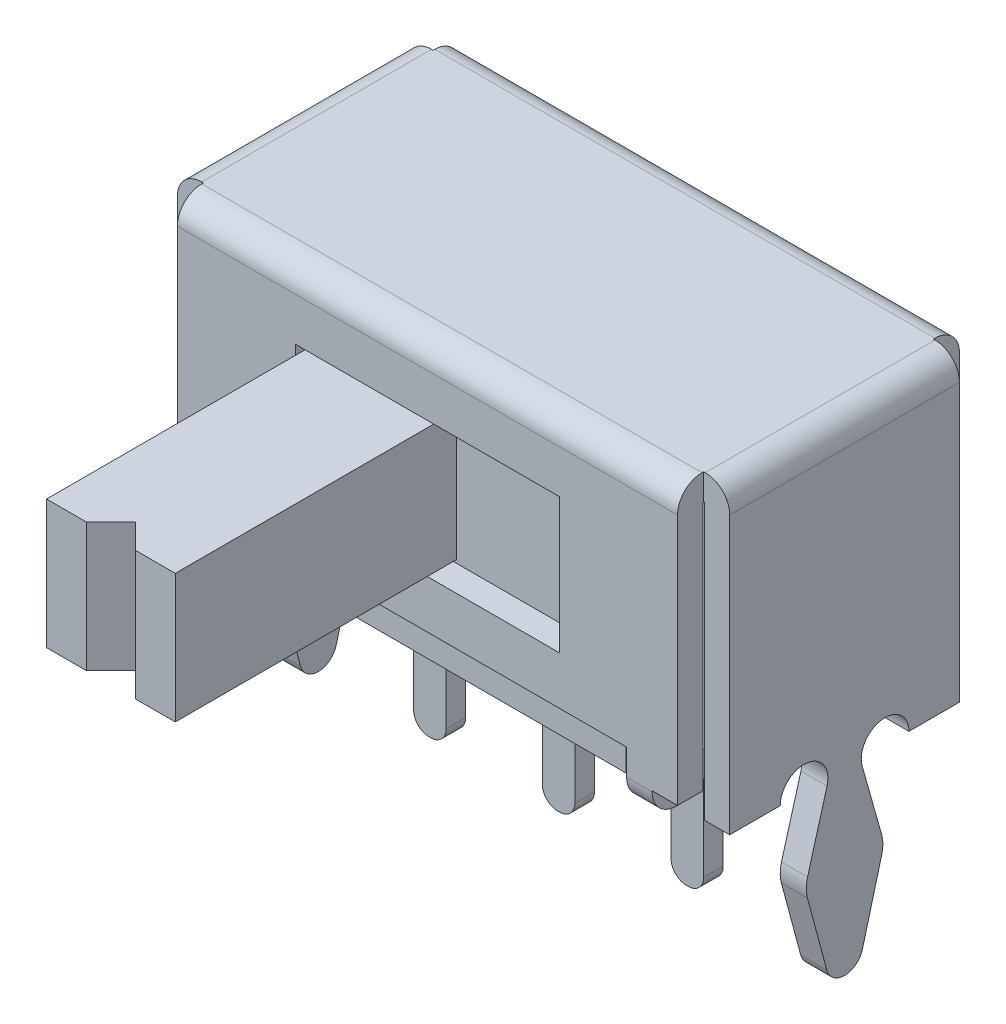
from build123d import *

# Parameters (mm, degrees)
SKETCH1_W           = 8.6106
SKETCH1_H           = 4.3942
BOSS_EXTRUDE1_DEPTH = 7.493
SKETCH2_W           = 0.4064
SKETCH2_H           = 0.4064
CUT_EXTRUDE1_DEPTH  = 13.230963781
CUT_EXTRUDE4_DEPTH  = 7.0866
FILLET8_R           = 0.381
CUT_EXTRUDE5_DEPTH  = 13.230963781
CUT_EXTRUDE6_DEPTH  = 13.230963781
BOSS_EXTRUDE2_DEPTH = 0.396875
SKETCH7_W           = 0.396875
SKETCH7_H           = 0.3937
BOSS_EXTRUDE3_DEPTH = 0.396875
SKETCH8_W           = 0.396875
SKETCH8_H           = 0.396875
BOSS_EXTRUDE4_DEPTH = 0.396875
FILLET9_R           = 0.381
FILLET10_R          = 0.0508
CUT_EXTRUDE7_REACH  = 14.231
SKETCH9_W           = 4.1148
SKETCH9_H           = 2.1082
SKETCH11_W          = 2.0066
SKETCH11_H          = 2.0066
BOSS_EXTRUDE5_DEPTH = 4.384675
SKETCH12_W          = 4.487424853
SKETCH12_H          = 2.672562517
BOSS_EXTRUDE6_DEPTH = 1.5748
CUT_EXTRUDE10_REACH = 13.587
SKETCH14_W          = 0.508
SKETCH14_H          = 0.3048
BOSS_EXTRUDE7_DEPTH = 3.048
FILLET11_R          = 0.2413


with BuildPart() as part:
    # Sketch1 → Boss-Extrude1 (new body)
    with BuildSketch(Plane(origin=(0, 0, 0), x_dir=(1, 0, 0), z_dir=(0, 1, 0))):
        with Locations((4.3053, 2.1971)):
            Rectangle(SKETCH1_W, SKETCH1_H)
    extrude(amount=-BOSS_EXTRUDE1_DEPTH)

    # Sketch2 → Cut-Extrude1 (cut, through all)
    with BuildSketch(Plane(origin=(0, 0, 0), x_dir=(1, 0, 0), z_dir=(0, 1, 0))):
        with Locations((8.4074, 4.191)):
            Rectangle(SKETCH2_W, SKETCH2_H)
        with Locations((0.2032, 4.191)):
            Rectangle(SKETCH2_W, SKETCH2_H)
        with Locations((8.4074, 0.2032)):
            Rectangle(SKETCH2_W, SKETCH2_H)
        with Locations((0.2032, 0.2032)):
            Rectangle(SKETCH2_W, SKETCH2_H)
    extrude(amount=-CUT_EXTRUDE1_DEPTH, mode=Mode.SUBTRACT)

    # Sketch3 → Cut-Extrude4 (cut)
    with BuildSketch(Plane.XZ.offset(7.493)):
        with BuildLine():
            Line((0.4191, -0.4064), (8.1915, -0.4064))
            ThreePointArc((8.1915, -0.4064), (8.213180256, -0.397419744), (8.2042, -0.4191))
            Line((8.2042, -0.4191), (8.2042, -3.9751))
            ThreePointArc((8.2042, -3.9751), (8.213180256, -3.996780256), (8.1915, -3.9878))
            Line((8.1915, -3.9878), (0.4191, -3.9878))
            ThreePointArc((0.4191, -3.9878), (0.397419744, -3.996780256), (0.4064, -3.9751))
            Line((0.4064, -3.9751), (0.4064, -0.4191))
            ThreePointArc((0.4064, -0.4191), (0.397419744, -0.397419744), (0.4191, -0.4064))
        make_face()
    extrude(amount=-CUT_EXTRUDE4_DEPTH, mode=Mode.SUBTRACT)

    # Fillet8
    fillet8_edges = [part.edges().sort_by_distance(p)[0] for p in [
        (0, 0, -2.1971),
        (4.3053, 0, -4.3942),
        (8.6106, 0, -2.1971),
        (4.3053, 0, 0),
    ]]
    fillet(fillet8_edges, radius=FILLET8_R)

    # Sketch4 → Cut-Extrude5 (cut, through all)
    with BuildSketch(Plane.XY):
        Polygon((1.20015, -3.9116), (7.41045, -3.9116), (7.41045, -4.699), (7.807325, -4.699), (7.807325, -4.302125), (8.2042, -4.302125), (8.2042, -7.493), (0.4064, -7.493), (0.4064, -4.302125), (0.803275, -4.302125), (0.803275, -4.699), (1.20015, -4.699), align=None)
    extrude(amount=-CUT_EXTRUDE5_DEPTH, mode=Mode.SUBTRACT)

    # Sketch5 → Cut-Extrude6 (cut, through all)
    with BuildSketch(Plane(origin=(8.6106, 0, 0), x_dir=(0, 0, -1), z_dir=(1, 0, 0))):
        with BuildLine():
            Line((0.4064, -4.699), (1.1938, -4.699))
            ThreePointArc((1.1938, -4.699), (1.616523828, -4.330724179), (1.923404732, -4.799922032))
            Line((1.923404732, -4.799922032), (1.620182585, -5.875006123))
            ThreePointArc((1.620182585, -5.875006123), (1.600211037, -6.016040651), (1.61836436, -6.157320719))
            Line((1.61836436, -6.157320719), (1.91945657, -7.280006107))
            ThreePointArc((1.91945657, -7.280006107), (2.022134094, -7.433618006), (2.1971, -7.493))
            ThreePointArc((2.1971, -7.493), (2.372065906, -7.433618006), (2.47474343, -7.280006107))
            Line((2.47474343, -7.280006107), (2.77583564, -6.157320719))
            ThreePointArc((2.77583564, -6.157320719), (2.793988963, -6.016040651), (2.774017415, -5.875006123))
            Line((2.774017415, -5.875006123), (2.470795268, -4.799922032))
            ThreePointArc((2.470795268, -4.799922032), (2.777676172, -4.330724179), (3.2004, -4.699))
            Line((3.2004, -4.699), (3.9878, -4.699))
            Line((3.9878, -4.699), (3.9878, -7.640446321))
            Line((3.9878, -7.640446321), (0.4064, -7.640446321))
            Line((0.4064, -7.640446321), (0.4064, -4.699))
        make_face()
    extrude(amount=-CUT_EXTRUDE6_DEPTH, mode=Mode.SUBTRACT)



with BuildPart() as body_2:
    # Sketch6 → Boss-Extrude2 (new body)
    with BuildSketch(Plane.XZ.offset(3.9116)):
        Polygon((0.455456934, -0.567114284), (1.251351798, -0.567114284), (1.251351798, -0.041523335), (7.355715241, -0.041523335), (7.355715241, -0.567114284), (8.159118548, -0.567114284), (8.159118548, -3.810761279), (7.355715241, -3.810761279), (7.355715241, -4.351369112), (1.251351798, -4.351369112), (1.251351798, -3.810761279), (0.455456934, -3.810761279), align=None)
    extrude(amount=BOSS_EXTRUDE2_DEPTH)


with BuildPart() as part_1:
    add(part.part)

    add(body_2.part)  # Boss-Extrude3 merges body 2
    # Sketch7 → Boss-Extrude3 (add)
    with BuildSketch(Plane(origin=(0, 0, -0.4064), x_dir=(-1, 0, 0), z_dir=(0, 0, -1))):
        with Locations((-1.0017125, -4.50215)):
            Rectangle(SKETCH7_W, SKETCH7_H)
        with Locations((-7.6088875, -4.50215)):
            Rectangle(SKETCH7_W, SKETCH7_H)
    extrude(amount=BOSS_EXTRUDE3_DEPTH)

    # Sketch8 → Boss-Extrude4 (add)
    with BuildSketch(Plane.XY.offset(-3.9878)):
        with Locations((1.0017125, -4.5005625)):
            Rectangle(SKETCH8_W, SKETCH8_H)
        with Locations((7.6088875, -4.5005625)):
            Rectangle(SKETCH8_W, SKETCH8_H)
    extrude(amount=BOSS_EXTRUDE4_DEPTH)

    # Fillet9
    fillet9_edges = [part_1.edges().sort_by_distance(p)[0] for p in [
        (7.6088875, -4.699, -4.3942),
        (1.0017125, -4.699, -4.3942),
        (1.0017125, -4.699, 0),
        (7.6088875, -4.699, 0),
    ]]
    fillet(fillet9_edges, radius=FILLET9_R)

    # Fillet10
    # the kernel refuses this fillet: 0.0508 mm, written as the material it adds along each edge
    with BuildSketch(Plane(origin=(1.20015, -4.3053, -0.4064), x_dir=(0, 1, 0), z_dir=(-1, 0, 0)), Plane(origin=(0.803275, -4.302125, -3.9878), x_dir=(0, 1, 0), z_dir=(1, 0, 0))) as fillet10_piece_1:
        with BuildLine():
            CenterArc((FILLET10_R, FILLET10_R), FILLET10_R, 180, 90)
            Line((0, FILLET10_R), (0, 0))
            Line((0, 0), (FILLET10_R, 0))
        make_face()
    extrude(amount=0.396875)
    with BuildSketch(Plane(origin=(7.41045, -4.3053, -0.4064), x_dir=(0, 1, 0), z_dir=(1, 0, 0)), Plane(origin=(7.807325, -4.302125, -3.9878), x_dir=(0, 1, 0), z_dir=(-1, 0, 0))) as fillet10_piece_2:
        with BuildLine():
            CenterArc((FILLET10_R, -FILLET10_R), FILLET10_R, 90, 90)
            Line((0, -FILLET10_R), (0, 0))
            Line((0, 0), (FILLET10_R, 0))
        make_face()
    extrude(amount=0.396875)

    # Sketch9 → Cut-Extrude7 (cut, up to next)
    with BuildSketch(Plane.XY, mode=Mode.PRIVATE) as cut_extrude7_sk1:
        with Locations((4.3053, -2.1082)):
            Rectangle(SKETCH9_W, SKETCH9_H)
    cut_extrude7_tool1 = extrude(cut_extrude7_sk1.sketch, amount=-CUT_EXTRUDE7_REACH, mode=Mode.PRIVATE) & part_1.part
    add(cut_extrude7_tool1.solids().sort_by_distance((4.3053, -2.1082, 0))[0], mode=Mode.SUBTRACT)



with BuildPart() as body_2_2:
    # Sketch11 → Boss-Extrude5 (new body)
    with BuildSketch(Plane(origin=(0, 0, -0.4064), x_dir=(-1, 0, 0), z_dir=(0, 0, -1))):
        with Locations((-3.349764598, -2.1082)):
            Rectangle(SKETCH11_W, SKETCH11_H)
    extrude(amount=-BOSS_EXTRUDE5_DEPTH)


with BuildPart() as part_2:
    add(part_1.part)

    add(body_2_2.part)  # Boss-Extrude6 merges body 2 2
    # Sketch12 → Boss-Extrude6 (add)
    with BuildSketch(Plane(origin=(0, 0, -0.4064), x_dir=(-1, 0, 0), z_dir=(0, 0, -1))):
        with Locations((-4.248970079, -2.082014044)):
            Rectangle(SKETCH12_W, SKETCH12_H)
    extrude(amount=BOSS_EXTRUDE6_DEPTH)

    # Sketch13 → Cut-Extrude10 (cut, up to next)
    with BuildSketch(Plane(origin=(0, -1.1049, 0), x_dir=(1, 0, 0), z_dir=(0, 1, 0)), mode=Mode.PRIVATE) as cut_extrude10_sk1:
        Polygon((2.968764598, -3.978275), (3.349764598, -3.597275), (3.730764598, -3.978275), align=None)
    cut_extrude10_tool1 = extrude(cut_extrude10_sk1.sketch, amount=-CUT_EXTRUDE10_REACH, mode=Mode.PRIVATE) & part_2.part
    add(cut_extrude10_tool1.solids().sort_by_distance((3.349765, -1.1049, 3.851275))[0], mode=Mode.SUBTRACT)

    # Sketch14 → Boss-Extrude7 (add)
    with BuildSketch(Plane.XZ.offset(4.308475)):
        with Locations((6.3119, -2.1971)):
            Rectangle(SKETCH14_W, SKETCH14_H)
        with Locations((2.2987, -2.1971)):
            Rectangle(SKETCH14_W, SKETCH14_H)
        with Locations((4.3053, -2.1971)):
            Rectangle(SKETCH14_W, SKETCH14_H)
    extrude(amount=BOSS_EXTRUDE7_DEPTH)

    # Fillet11
    fillet11_edges = [part_2.edges().sort_by_distance(p)[0] for p in [
        (6.5659, -7.356475, -2.1971),
        (6.0579, -7.356475, -2.1971),
        (2.5527, -7.356475, -2.1971),
        (2.0447, -7.356475, -2.1971),
        (4.5593, -7.356475, -2.1971),
        (4.0513, -7.356475, -2.1971),
    ]]
    fillet(fillet11_edges, radius=FILLET11_R)


solid = part_2.part
